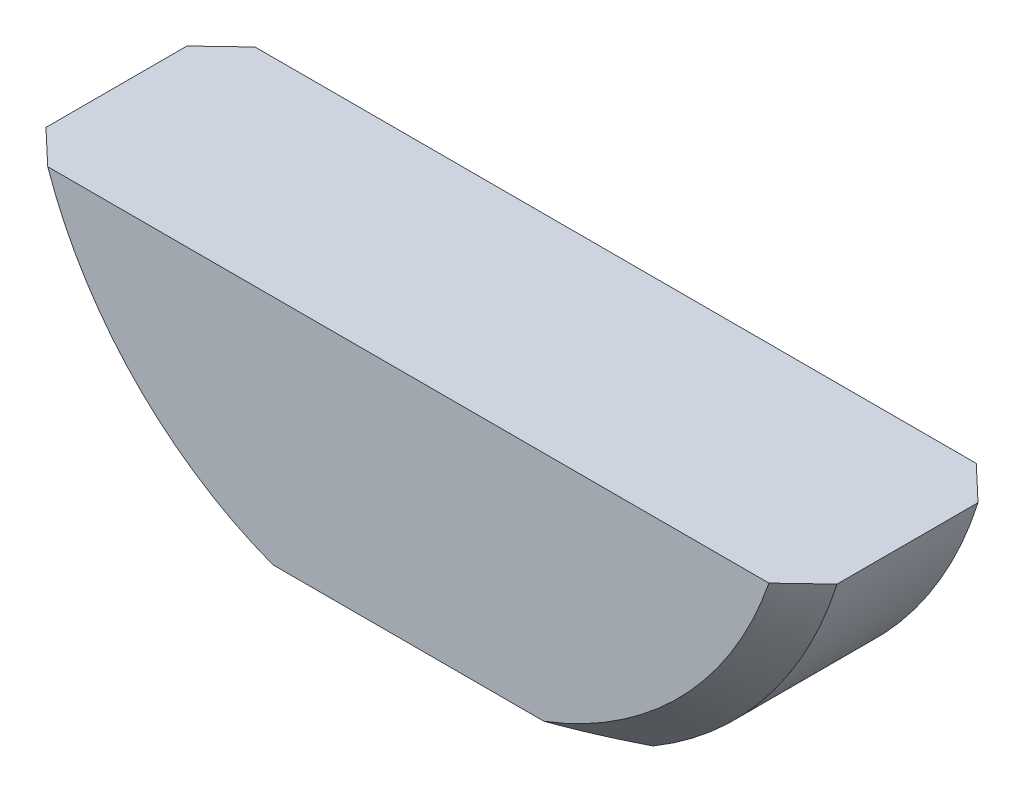
from build123d import *

# Parameters (mm, degrees)
EXTRUDE1_DEPTH          = 1
CUT_EXTRUDE1_DEPTH      = 3.569046516
CUT_EXTRUDE1_DEPTH_BACK = 3.569046516
CHAMFER1_SIZE           = 0.16


with BuildPart() as part:
    # Sketch1 → Extrude1 (new body)
    with BuildSketch(Plane.XY):
        with BuildLine():
            Line((-1.907878403, 0), (1.907878403, 0))
            ThreePointArc((1.907878403, 0), (0, -1.4), (-1.907878403, 0))
        make_face()
    extrude(amount=EXTRUDE1_DEPTH)

    # Sketch2 → Cut-Extrude1 (cut, two sides: drawn at the far end of the back side and taken through both)
    with BuildSketch(Plane.XY.offset(-CUT_EXTRUDE1_DEPTH_BACK)):
        Polygon((-19.861343057, -1.12), (-1.907878403, -1.12), (1.907878403, -1.12), (19.861343057, -1.12), (19.861343057, -37.026929308), (-19.861343057, -37.026929308), align=None)
    extrude(amount=CUT_EXTRUDE1_DEPTH + CUT_EXTRUDE1_DEPTH_BACK, mode=Mode.SUBTRACT)

    # Chamfer1
    chamfer1_edges = [part.edges().sort_by_distance(p)[0] for p in [
        (-1.567666726, -0.641942445, 0),
        (1.567666726, -0.641942445, 0),
        (1.567666726, -0.641942445, 1),
        (-1.567666726, -0.641942445, 1),
    ]]
    chamfer(chamfer1_edges, length=CHAMFER1_SIZE)


solid = part.part
